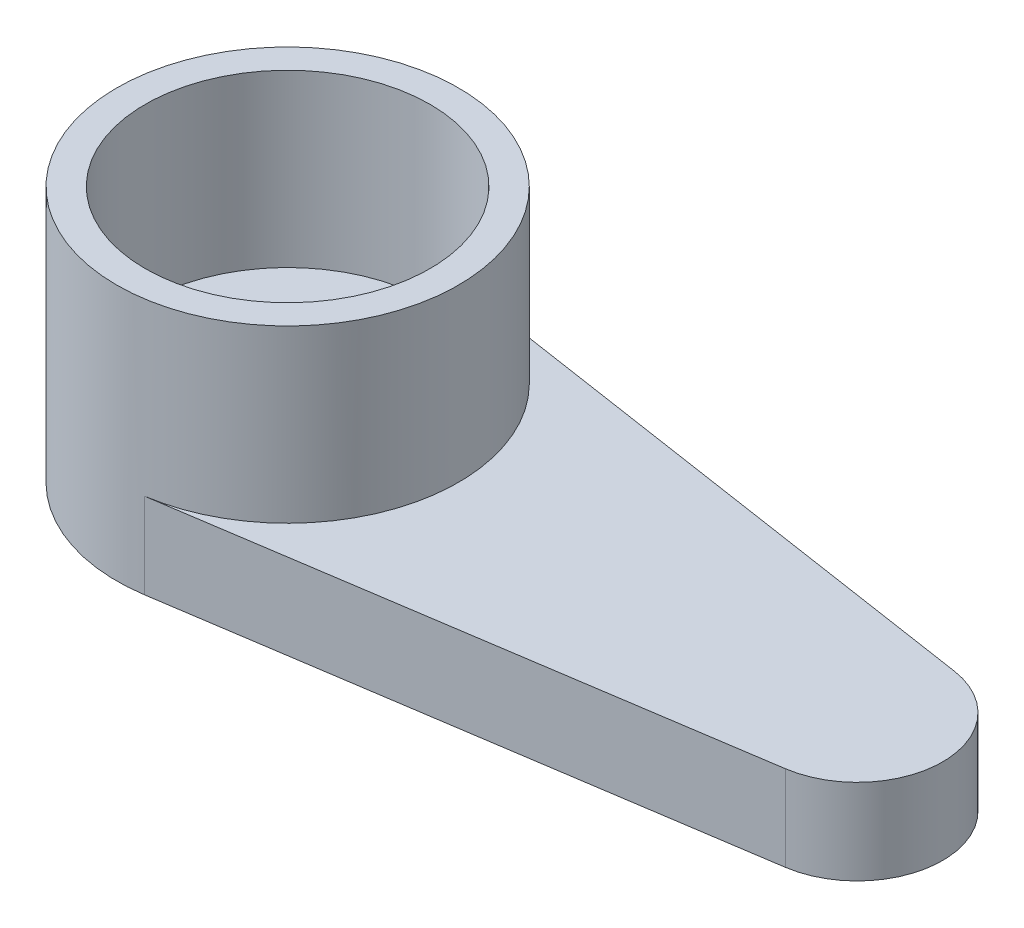
from build123d import *

# Parameters (mm, degrees)
SKETCH1_R           = 1.5
BOSS_EXTRUDE1_DEPTH = 1.5
SKETCH2_R           = 3
SKETCH2_R_2         = 2.5
BOSS_EXTRUDE2_DEPTH = 3


with BuildPart() as part:
    # Sketch1 → Boss-Extrude1 (new body)
    with BuildSketch(Plane(origin=(0, 0, 0), x_dir=(1, 0, 0), z_dir=(0, 1, 0))):
        with BuildLine():
            Line((0.45, 2.96605799), (10.225, 1.483028995))
            ThreePointArc((10.225, 1.483028995), (11.5, 0), (10.225, -1.483028995))
            Line((10.225, -1.483028995), (0.45, -2.96605799))
            ThreePointArc((0.45, -2.96605799), (-3, 0), (0.45, 2.96605799))
        make_face()
        Circle(SKETCH1_R, mode=Mode.SUBTRACT)
    extrude(amount=BOSS_EXTRUDE1_DEPTH)

    # Sketch2 → Boss-Extrude2 (add)
    with BuildSketch(Plane(origin=(0, 1.5, 0), x_dir=(1, 0, 0), z_dir=(0, 1, 0))):
        Circle(SKETCH2_R)
        Circle(SKETCH2_R_2, mode=Mode.SUBTRACT)
    extrude(amount=BOSS_EXTRUDE2_DEPTH)


solid = part.part
